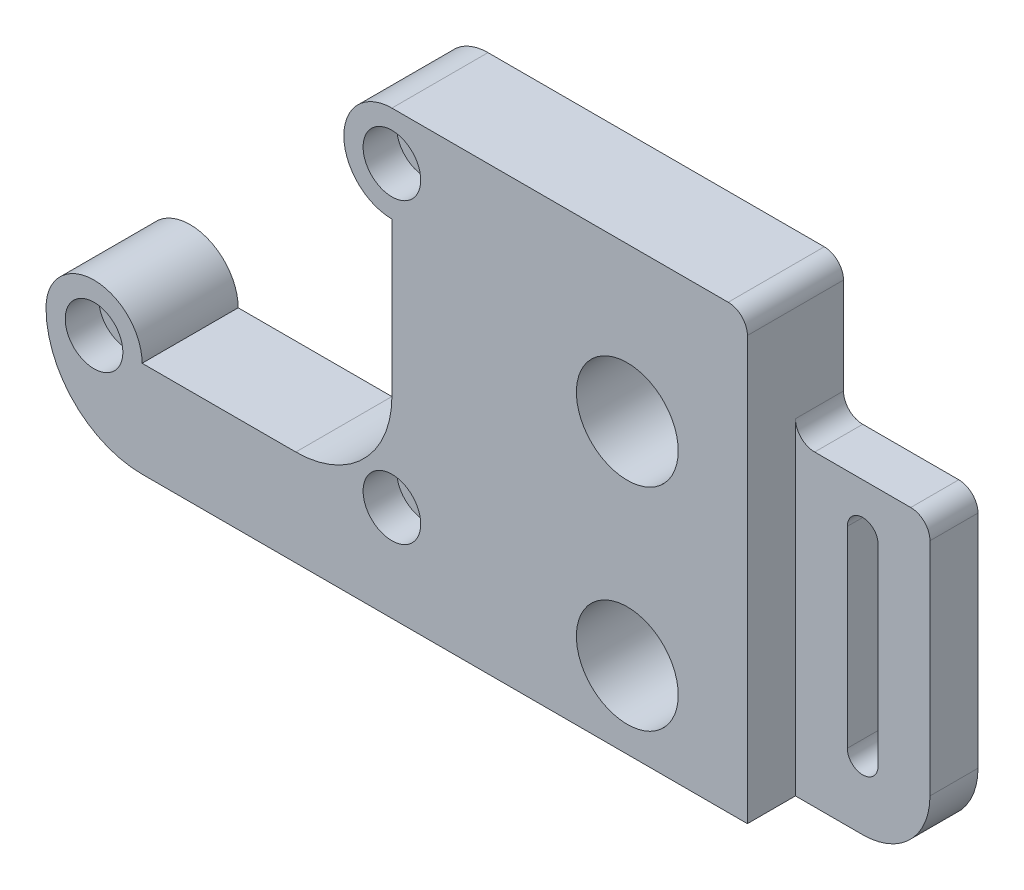
from build123d import *

# Parameters (mm, degrees)
SKETCH1_R           = 1.8
SKETCH1_R_2         = 5.3
BOSS_EXTRUDE1_DEPTH = 10
SKETCH2_R           = 3
CUT_EXTRUDE1_DEPTH  = 3.5
CUT_EXTRUDE2_START  = -5
CUT_EXTRUDE2_DEPTH  = 5


with BuildPart() as part:
    # Sketch1 → Boss-Extrude1 (new body)
    with BuildSketch(Plane.XY):
        with BuildLine():
            Line((35, 5), (0, 5))
            ThreePointArc((0, 5), (-5, 0), (0, -5))
            Line((0, -5), (0, -21))
            ThreePointArc((0, -21), (-2.928932188, -28.071067812), (-10, -31))
            Line((-10, -31), (-26, -31))
            ThreePointArc((-26, -31), (-31, -26), (-36, -31))
            ThreePointArc((-36, -31), (-33.071067812, -38.071067812), (-26, -41))
            Line((-26, -41), (44, -41))
            ThreePointArc((44, -41), (48.949747468, -38.949747468), (51, -34))
            Line((51, -34), (51, -11))
            ThreePointArc((51, -11), (50.414213562, -9.585786438), (49, -9))
            Line((49, -9), (39, -9))
            ThreePointArc((39, -9), (37.585786438, -8.414213562), (37, -7))
            Line((37, -7), (37, 3))
            ThreePointArc((37, 3), (36.414213562, 4.414213562), (35, 5))
        make_face()
        with Locations((-31, -31)):
            Circle(SKETCH1_R, mode=Mode.SUBTRACT)
        with Locations((0, -31)):
            Circle(SKETCH1_R, mode=Mode.SUBTRACT)
        with Locations((24.5, -33)):
            Circle(SKETCH1_R_2, mode=Mode.SUBTRACT)
        with BuildLine():
            ThreePointArc((45.6, -34), (44, -35.6), (42.4, -34))
            Line((42.4, -34), (42.4, -14))
            ThreePointArc((42.4, -14), (44, -12.4), (45.6, -14))
            Line((45.6, -14), (45.6, -34))
        make_face(mode=Mode.SUBTRACT)
        Circle(SKETCH1_R, mode=Mode.SUBTRACT)
        with Locations((24.5, -11)):
            Circle(SKETCH1_R_2, mode=Mode.SUBTRACT)
    extrude(amount=BOSS_EXTRUDE1_DEPTH)

    # Sketch2 → Cut-Extrude1 (cut)
    with BuildSketch(Plane.XY.offset(10)):
        with Locations((-31, -31)):
            Circle(SKETCH2_R)
        with Locations((0, -31)):
            Circle(SKETCH2_R)
        Circle(SKETCH2_R)
    extrude(amount=-CUT_EXTRUDE1_DEPTH, mode=Mode.SUBTRACT)

    # Sketch3 → Cut-Extrude2 (cut)
    with BuildSketch(Plane.XY.offset(10).offset(CUT_EXTRUDE2_START)):
        with BuildLine():
            Line((37, -41), (37, 5))
            Line((37, 5), (51, 5))
            Line((51, 5), (51, -34))
            ThreePointArc((51, -34), (48.949747468, -38.949747468), (44, -41))
            Line((44, -41), (37, -41))
        make_face()
    extrude(amount=CUT_EXTRUDE2_DEPTH, mode=Mode.SUBTRACT)


solid = part.part
